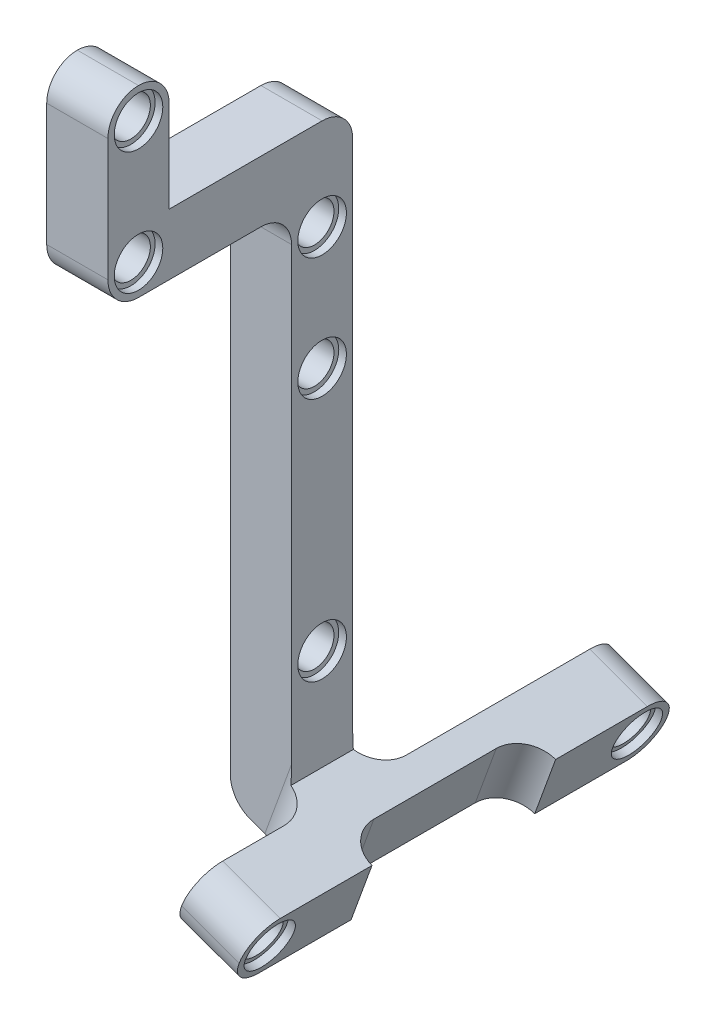
from build123d import *

# Parameters (mm, degrees)
SKETCH1_R           = 2.55
BOSS_EXTRUDE1_DEPTH = 8
SKETCH2_R           = 3.175
CUT_EXTRUDE1_DEPTH  = 1
CUT_EXTRUDE2_START  = -1
SKETCH3_R           = 3.175
CUT_EXTRUDE2_DEPTH  = 1
BOSS_EXTRUDE2_DEPTH = 8
SKETCH5_W           = 8
SKETCH5_H           = 56
BOSS_EXTRUDE3_DEPTH = 8
SKETCH6_W           = 4
SKETCH6_H           = 24
CUT_EXTRUDE3_DEPTH  = 8
FILLET2_R           = 4
SKETCH7_R           = 2.55
CUT_EXTRUDE4_DEPTH  = 8
SKETCH8_R           = 3.175
CUT_EXTRUDE5_DEPTH  = 1
CUT_EXTRUDE6_START  = -1
SKETCH9_R           = 3.175
CUT_EXTRUDE6_DEPTH  = 1
FILLET3_R           = 4
FILLET5_R           = 4


# Some blends are built 0.0001 mm under size
with BuildPart() as part:
    # Sketch1 → Boss-Extrude1 (new body)
    with BuildSketch(Plane.YZ):
        Polygon((0, 0), (72, 0), (72, 24), (88, 24), (88, 32), (64, 32), (64, 8), (0, 8), align=None)
        with Locations(Location((12, 4, 0), (0, 0, 270))):
            Circle(SKETCH1_R, mode=Mode.SUBTRACT)
        with Locations(Location((44, 4, 0), (0, 0, 270))):
            Circle(SKETCH1_R, mode=Mode.SUBTRACT)
        with Locations(Location((60, 4, 0), (0, 0, 270))):
            Circle(SKETCH1_R, mode=Mode.SUBTRACT)
        with Locations(Location((68, 28, 0), (0, 0, 270))):
            Circle(SKETCH1_R, mode=Mode.SUBTRACT)
        with Locations(Location((84, 28, 0), (0, 0, 270))):
            Circle(SKETCH1_R, mode=Mode.SUBTRACT)
    extrude(amount=BOSS_EXTRUDE1_DEPTH)

    # Sketch2 → Cut-Extrude1 (cut)
    with BuildSketch(Plane.YZ.offset(8)):
        with Locations(Location((68, 28, 0), (0, 0, 270))):
            Circle(SKETCH2_R)
        with Locations(Location((84, 28, 0), (0, 0, 270))):
            Circle(SKETCH2_R)
        with Locations(Location((12, 4, 0), (0, 0, 270))):
            Circle(SKETCH2_R)
        with Locations(Location((44, 4, 0), (0, 0, 270))):
            Circle(SKETCH2_R)
        with Locations(Location((60, 4, 0), (0, 0, 270))):
            Circle(SKETCH2_R)
    extrude(amount=-CUT_EXTRUDE1_DEPTH, mode=Mode.SUBTRACT)

    # Sketch3 → Cut-Extrude2 (cut)
    with BuildSketch(Plane(origin=(0, 0, 0), x_dir=(0, -1, 0), z_dir=(-1, 0, 0)).offset(CUT_EXTRUDE2_START)):
        with Locations(Location((-12, 4, 0), (0, 0, 270))):
            Circle(SKETCH3_R)
        with Locations(Location((-84, 28, 0), (0, 0, 270))):
            Circle(SKETCH3_R)
        with Locations(Location((-68, 28, 0), (0, 0, 270))):
            Circle(SKETCH3_R)
        with Locations(Location((-60, 4, 0), (0, 0, 270))):
            Circle(SKETCH3_R)
        with Locations(Location((-44, 4, 0), (0, 0, 270))):
            Circle(SKETCH3_R)
    extrude(amount=CUT_EXTRUDE2_DEPTH, mode=Mode.SUBTRACT)

    # Sketch4 → Boss-Extrude2 (add)
    with BuildSketch(Plane.XY.offset(8)):
        with BuildLine():
            Line((0, 0), (0, -4))
            ThreePointArc((0, -4), (0.723391823, -6.294305745), (2.631919427, -7.758770483))
            Line((2.631919427, -7.758770483), (15.787616118, -12.54705249))
            Line((15.787616118, -12.54705249), (18.523777264, -5.029511523))
            Line((18.523777264, -5.029511523), (8, -1.199169847))
            Line((8, -1.199169847), (8, 0))
            Line((8, 0), (0, 0))
        make_face()
    extrude(amount=-BOSS_EXTRUDE2_DEPTH)

    # Sketch5 → Boss-Extrude3 (add)
    with BuildSketch(Plane(origin=(0.550416468, 1.512256816, 0), x_dir=(-0.9396926207859096, 0.34202014332566544, 0), z_dir=(0.3420201433256654, 0.9396926207859095, 0))):
        with Locations((-15.126851056, -4)):
            Rectangle(SKETCH5_W, SKETCH5_H)
    extrude(amount=-BOSS_EXTRUDE3_DEPTH)

    # Sketch6 → Cut-Extrude3 (cut)
    with BuildSketch(Plane(origin=(0.550416468, 1.512256816, 0), x_dir=(-0.9396926207859096, 0.34202014332566544, 0), z_dir=(0.3420201433256654, 0.9396926207859095, 0))):
        with Locations((-17.126851056, -4)):
            Rectangle(SKETCH6_W, SKETCH6_H)
    extrude(amount=-CUT_EXTRUDE3_DEPTH, mode=Mode.SUBTRACT)

    # Fillet2
    # the kernel refuses this fillet: 4 mm, written as the material it adds along each edge
    with BuildSketch(Plane(origin=(8.270075151, -9.810891343, 0), x_dir=(-0.9396926207859096, 0.34202014332566544, 0), z_dir=(0.34202014332566544, 0.9396926207859096, 0))) as fillet2_piece_1_section:
        with BuildLine():
            CenterArc((FILLET2_R, -FILLET2_R), FILLET2_R, 90, 90)
            Line((0, -FILLET2_R), (0, 0))
            Line((0, 0), (FILLET2_R, 0))
        make_face()
    fillet2_piece_1 = extrude(amount=8, mode=Mode.PRIVATE)
    fillet2_piece_1 = split(fillet2_piece_1, bisect_by=Plane(origin=(8, -7.10901072, -0.334730566), z_dir=(-1, 0, 0)), keep=Keep.TOP, mode=Mode.PRIVATE)
    add(fillet2_piece_1)
    with BuildSketch(Plane(origin=(8.270075151, -9.810891343, 0), x_dir=(-0.9396926207859096, 0.34202014332566544, 0), z_dir=(0.34202014332566544, 0.9396926207859096, 0))) as fillet2_piece_2_section:
        with BuildLine():
            CenterArc((FILLET2_R, -FILLET2_R), FILLET2_R, 90, 90)
            Line((0, -FILLET2_R), (0, 0))
            Line((0, 0), (FILLET2_R, 0))
        make_face()
    fillet2_piece_2 = extrude(amount=8, mode=Mode.PRIVATE)
    fillet2_piece_2 = split(fillet2_piece_2, bisect_by=Plane(origin=(8, -5.333791146, -1.076258135), z_dir=(1, 0, 0)), keep=Keep.TOP, mode=Mode.PRIVATE)
    add(fillet2_piece_2)
    with BuildSketch(Plane(origin=(8.270075151, -9.810891343, 0), x_dir=(-0.9396926207859096, 0.34202014332566544, 0), z_dir=(0.34202014332566544, 0.9396926207859096, 0))) as fillet2_piece_3_section:
        with BuildLine():
            CenterArc((FILLET2_R, -FILLET2_R), FILLET2_R, 90, 90)
            Line((0, -FILLET2_R), (0, 0))
            Line((0, 0), (FILLET2_R, 0))
        make_face()
    fillet2_piece_3 = extrude(amount=18, mode=Mode.PRIVATE)
    fillet2_piece_3 = split(fillet2_piece_3, bisect_by=Plane(origin=(7.527179325, -1.027077195, 0.031937464), z_dir=(0.3420201433256657, 0.9396926207859095, 0)), keep=Keep.TOP, mode=Mode.PRIVATE)
    fillet2_piece_3 = split(fillet2_piece_3, bisect_by=Plane(origin=(8, -0.377545132, 0.031937464), z_dir=(-1, 0, 0)), keep=Keep.TOP, mode=Mode.PRIVATE)
    add(fillet2_piece_3)
    with BuildSketch(Plane(origin=(11.006236298, -2.293350377, 8), x_dir=(-0.9396926207859096, 0.3420201433256654, 0), z_dir=(-0.34202014332566544, -0.9396926207859096, 0))) as fillet2_piece_4_section:
        with BuildLine():
            CenterArc((FILLET2_R, -FILLET2_R), FILLET2_R, 90, 90)
            Line((0, -FILLET2_R), (0, 0))
            Line((0, 0), (FILLET2_R, 0))
        make_face()
    fillet2_piece_4 = extrude(amount=8, mode=Mode.PRIVATE)
    fillet2_piece_4 = split(fillet2_piece_4, bisect_by=Plane(origin=(8, -5.333791146, 9.076258135), z_dir=(1, 0, 0)), keep=Keep.TOP, mode=Mode.PRIVATE)
    add(fillet2_piece_4)
    with BuildSketch(Plane(origin=(14.426437731, 7.103575831, 8), x_dir=(-0.9396926207859096, 0.34202014332566544, 0), z_dir=(-0.34202014332566544, -0.9396926207859096, 0))) as fillet2_piece_5_section:
        with BuildLine():
            CenterArc((FILLET2_R, -FILLET2_R), FILLET2_R, 90, 90)
            Line((0, -FILLET2_R), (0, 0))
            Line((0, 0), (FILLET2_R, 0))
        make_face()
    fillet2_piece_5 = extrude(amount=18, mode=Mode.PRIVATE)
    fillet2_piece_5 = split(fillet2_piece_5, bisect_by=Plane(origin=(7.527179325, -1.027077195, 7.968062536), z_dir=(0.3420201433256657, 0.9396926207859095, 0)), keep=Keep.TOP, mode=Mode.PRIVATE)
    fillet2_piece_5 = split(fillet2_piece_5, bisect_by=Plane(origin=(8, -0.377545132, 7.968062536), z_dir=(-1, 0, 0)), keep=Keep.TOP, mode=Mode.PRIVATE)
    add(fillet2_piece_5)
    with BuildSketch(Plane(origin=(11.006236298, -2.293350377, 8), x_dir=(-0.9396926207859096, 0.3420201433256654, 0), z_dir=(-0.34202014332566544, -0.9396926207859096, 0))) as fillet2_piece_6_section:
        with BuildLine():
            CenterArc((FILLET2_R, -FILLET2_R), FILLET2_R, 90, 90)
            Line((0, -FILLET2_R), (0, 0))
            Line((0, 0), (FILLET2_R, 0))
        make_face()
    fillet2_piece_6 = extrude(amount=8, mode=Mode.PRIVATE)
    fillet2_piece_6 = split(fillet2_piece_6, bisect_by=Plane(origin=(8, -7.10901072, 8.334730566), z_dir=(-1, 0, 0)), keep=Keep.TOP, mode=Mode.PRIVATE)
    add(fillet2_piece_6)
    with BuildSketch(Plane(origin=(14.765006781, -3.66143095, -16), x_dir=(0, 0, 1), z_dir=(-0.34202014332566544, -0.9396926207859096, 0)), Plane(origin=(14.765006781, -3.66143095, 8), x_dir=(0.9396926207859096, -0.34202014332566544, 0), z_dir=(-0.34202014332566544, -0.9396926207859096, 0))) as fillet2_piece_7:
        with BuildLine():
            CenterArc((FILLET2_R, -FILLET2_R), FILLET2_R, 90, 90)
            Line((0, -FILLET2_R), (0, 0))
            Line((0, 0), (FILLET2_R, 0))
        make_face()
    extrude(amount=8)
    # the kernel refuses this fillet: 4 mm, written as the material it takes off along each edge
    with BuildSketch(Plane(origin=(1.60931009, 1.126851056, -32), x_dir=(-0.3420201433256655, -0.9396926207859096, 0), z_dir=(0.9396926207859096, -0.34202014332566544, 0)), Plane(origin=(27.920703472, -8.449712957, 24), x_dir=(-0.34202014332566544, -0.9396926207859096, 0), z_dir=(-0.9396926207859096, 0.34202014332566544, 0))) as fillet2_2_piece_1:
        with BuildLine():
            CenterArc((FILLET2_R, -FILLET2_R), FILLET2_R, 90, 90)
            Line((0, -FILLET2_R), (0, 0))
            Line((0, 0), (FILLET2_R, 0))
        make_face()
    extrude(amount=28, mode=Mode.SUBTRACT)
    with BuildSketch(Plane(origin=(-1.126851056, -6.39068991, -32), x_dir=(0.34202014332566544, 0.9396926207859096, 0), z_dir=(0.9396926207859096, -0.34202014332566544, 0)), Plane(origin=(25.184542326, -15.967253923, 24), x_dir=(0.34202014332566544, 0.9396926207859096, 0), z_dir=(-0.9396926207859096, 0.34202014332566544, 0))) as fillet2_2_piece_2:
        with BuildLine():
            CenterArc((FILLET2_R, FILLET2_R), FILLET2_R, 180, 90)
            Line((0, FILLET2_R), (0, 0))
            Line((0, 0), (FILLET2_R, 0))
        make_face()
    extrude(amount=28, mode=Mode.SUBTRACT)

    # Sketch7 → Cut-Extrude4 (cut)
    with BuildSketch(Plane(origin=(17.973360797, -6.54176834, 0), x_dir=(0.3420201433256649, 0.9396926207859099, 0), z_dir=(0.9396926207859099, -0.3420201433256649, 0))):
        with Locations((-2.39068991, 20)):
            Circle(SKETCH7_R)
        with Locations((-2.39068991, -28)):
            Circle(SKETCH7_R)
    extrude(amount=-CUT_EXTRUDE4_DEPTH, mode=Mode.SUBTRACT)

    # Sketch8 → Cut-Extrude5 (cut)
    with BuildSketch(Plane(origin=(17.973360797, -6.54176834, 0), x_dir=(0.3420201433256649, 0.9396926207859099, 0), z_dir=(0.9396926207859099, -0.3420201433256649, 0))):
        with Locations((-2.39068991, 20)):
            Circle(SKETCH8_R)
        with Locations((-2.39068991, -28)):
            Circle(SKETCH8_R)
    extrude(amount=-CUT_EXTRUDE5_DEPTH, mode=Mode.SUBTRACT)

    # Sketch9 → Cut-Extrude6 (cut)
    with BuildSketch(Plane(origin=(10.45581983, -3.805607193, 0), x_dir=(-0.3420201433256654, -0.9396926207859095, 0), z_dir=(-0.9396926207859095, 0.3420201433256654, 0)).offset(CUT_EXTRUDE6_START)):
        with Locations(Location((2.39068991, -28, 0), (0, 0, 180))):
            Circle(SKETCH9_R)
        with Locations(Location((2.39068991, 20, 0), (0, 0, 180))):
            Circle(SKETCH9_R)
    extrude(amount=CUT_EXTRUDE6_DEPTH, mode=Mode.SUBTRACT)

    # Fillet3
    fillet3_edges = [part.edges().sort_by_distance(p)[0] for p in [
        (4, 72, 0),
        (4, 64, 8),
    ]]
    fillet(fillet3_edges, radius=FILLET3_R)

    # Fillet5
    fillet5_edges = [part.edges().sort_by_distance(p)[0] for p in [
        (4, 88, 24),
        (4, 64, 32),
        (4, 88, 32),
    ]]
    fillet(fillet5_edges, radius=FILLET5_R - 0.0001)  # a hair under: the kernel refuses the full size


solid = part.part
